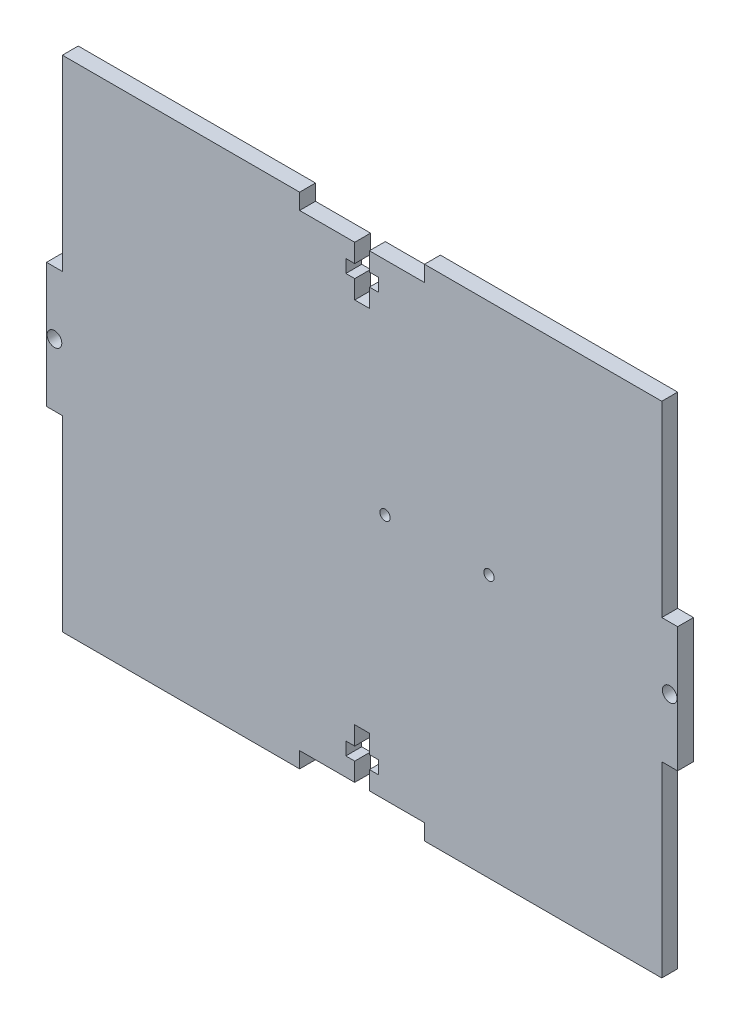
from build123d import *

# Parameters (mm, degrees)
SKETCH1_R           = 1.0287
SKETCH1_R_2         = 1.47
BOSS_EXTRUDE1_DEPTH = 1.5875


with BuildPart() as part:
    # Sketch1 → Boss-Extrude1 (new, symmetric)
    with BuildSketch(Plane.XY):
        Polygon((-12.5, 50), (-60, 50), (-60, 12.5), (-63.175, 12.5), (-63.175, -12.5), (-60, -12.5), (-60, -50), (-12.5, -50), (-12.5, -46.825), (-1.47, -46.825), (-1.47, -43.125), (-3.25, -43.125), (-3.25, -40.525), (-1.47, -40.525), (-1.47, -36.825), (1.47, -36.825), (1.47, -40.525), (3.25, -40.525), (3.25, -43.125), (1.47, -43.125), (1.47, -46.825), (12.5, -46.825), (12.5, -50), (60, -50), (60, -12.5), (63.175, -12.5), (63.175, 12.5), (60, 12.5), (60, 50), (12.5, 50), (12.5, 46.825), (1.47, 46.825), (1.47, 43.125), (3.25, 43.125), (3.25, 40.525), (1.47, 40.525), (1.47, 36.825), (-1.47, 36.825), (-1.47, 40.525), (-3.25, 40.525), (-3.25, 43.125), (-1.47, 43.125), (-1.47, 46.825), (-12.5, 46.825), align=None)
        with Locations((4.6, 2.575)):
            Circle(SKETCH1_R, mode=Mode.SUBTRACT)
        with Locations((25.4, 2.575)):
            Circle(SKETCH1_R, mode=Mode.SUBTRACT)
        with Locations((61.5875, 0)):
            Circle(SKETCH1_R_2, mode=Mode.SUBTRACT)
        with Locations((-61.5875, 0)):
            Circle(SKETCH1_R_2, mode=Mode.SUBTRACT)
    extrude(amount=BOSS_EXTRUDE1_DEPTH, both=True)


solid = part.part
